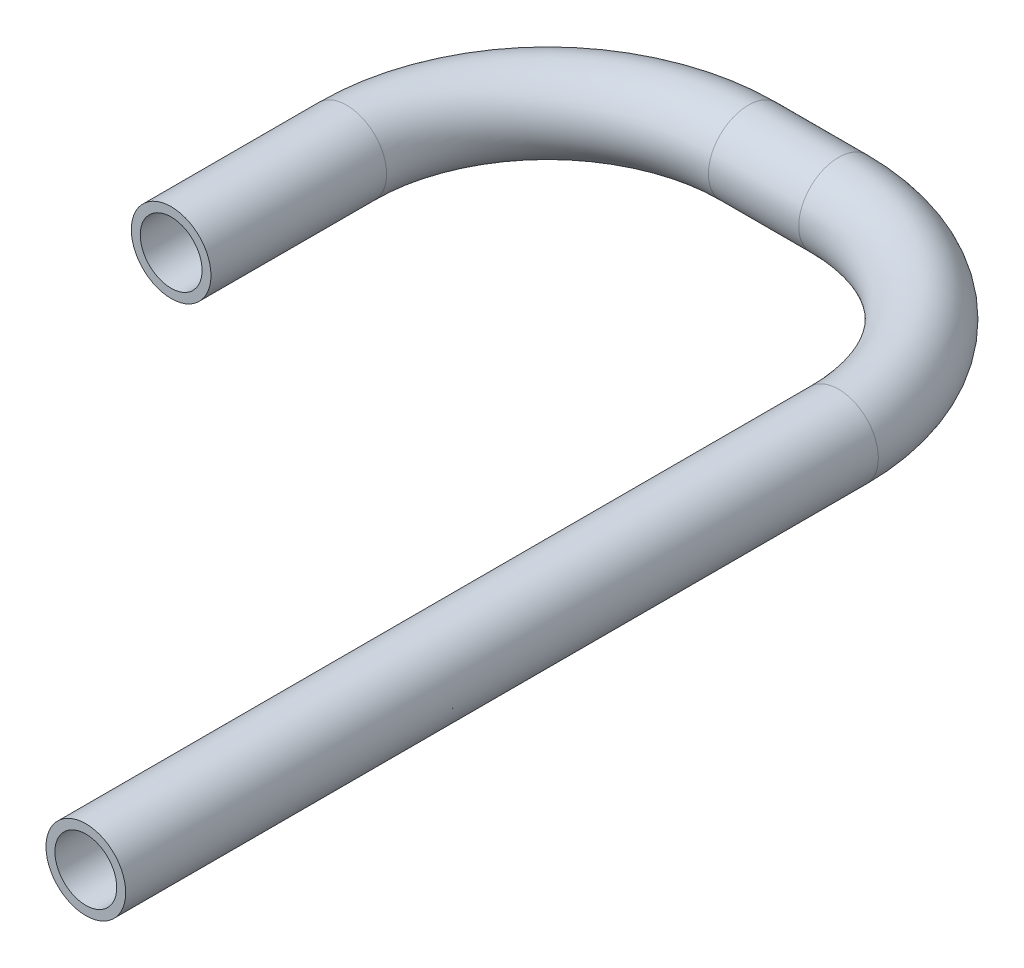
from build123d import *

# Parameters (mm, degrees)
SKETCH2_R   = 3.175
SKETCH2_R_2 = 2.4638


with BuildPart() as part:
    # Sweep-Thin1: sweep along a path in Sketch1
    with BuildLine(Plane(origin=(0, 0, 0), x_dir=(1, 0, 0), z_dir=(0, 1, 0))) as sweep_thin1_path:
        Line((0, 0), (0, 14))
        ThreePointArc((0, 14), (4.686291501, 25.313708499), (16, 30))
        Line((16, 30), (23.2, 30))
        ThreePointArc((23.2, 30), (34.513708499, 25.313708499), (39.2, 14))
        Line((39.2, 14), (39.2, -46))
    # Sketch2 → Sweep-Thin1 (sweep)
    with BuildSketch(Plane.XY):
        Circle(SKETCH2_R)
        Circle(SKETCH2_R_2, mode=Mode.SUBTRACT)
    sweep(path=sweep_thin1_path.line)


solid = part.part
